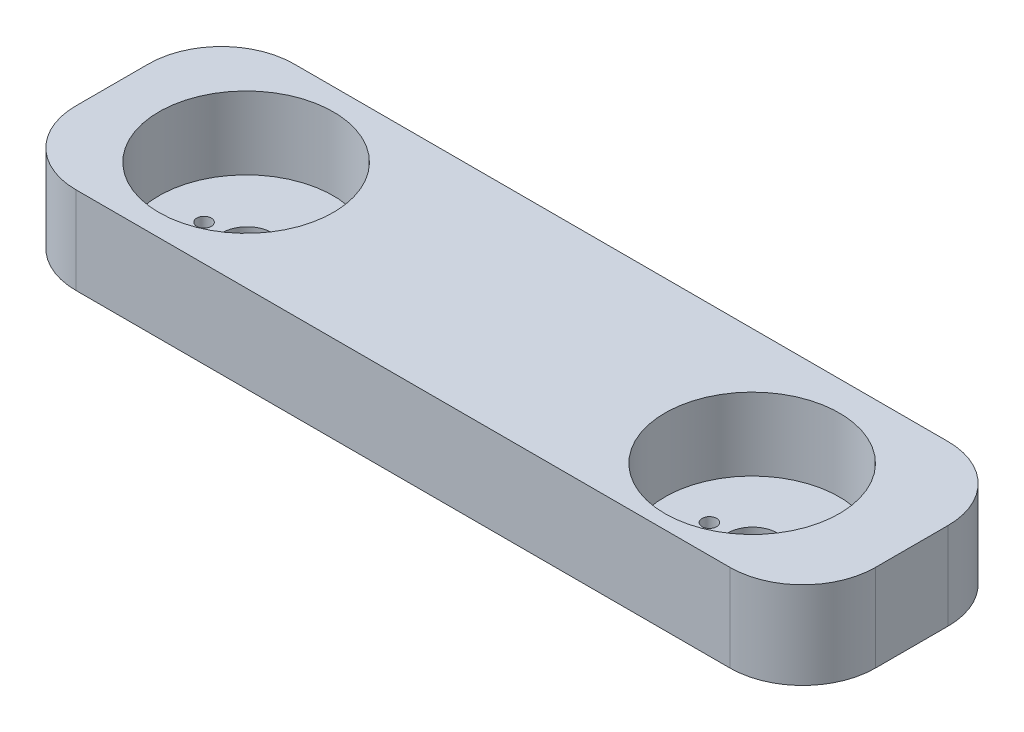
from build123d import *

# Parameters (mm, degrees)
SKETCH1_W           = 110
SKETCH1_H           = 30
BOSS_EXTRUDE1_DEPTH = 12
FILLET1_R           = 10
FILLET2_R           = 10
SKETCH9_R           = 12
CUT_EXTRUDE5_DEPTH  = 10
SKETCH13_R          = 12
CUT_EXTRUDE7_DEPTH  = 10
SKETCH15_R          = 3.43
SKETCH15_R_2        = 1
CUT_EXTRUDE8_DEPTH  = 123.308661002
SKETCH16_R          = 3.43
SKETCH16_R_2        = 1
CUT_EXTRUDE9_DEPTH  = 123.308661002


with BuildPart() as part:
    # Sketch1 → Boss-Extrude1 (new body)
    with BuildSketch(Plane(origin=(0, 0, 0), x_dir=(1, 0, 0), z_dir=(0, 1, 0))):
        with Locations((5.385430756, 3.53837453)):
            Rectangle(SKETCH1_W, SKETCH1_H)
    extrude(amount=BOSS_EXTRUDE1_DEPTH)

    # Fillet1
    fillet1_edges = [part.edges().sort_by_distance(p)[0] for p in [
        (-49.614569244, 6, -18.53837453),
        (-49.614569244, 6, 11.46162547),
    ]]
    fillet(fillet1_edges, radius=FILLET1_R)

    # Fillet2
    fillet2_edges = [part.edges().sort_by_distance(p)[0] for p in [
        (60.385430756, 6, -18.53837453),
        (60.385430756, 6, 11.46162547),
    ]]
    fillet(fillet2_edges, radius=FILLET2_R)

    # Sketch9 → Cut-Extrude5 (cut)
    with BuildSketch(Plane(origin=(0, 12, 0), x_dir=(1, 0, 0), z_dir=(0, 1, 0))):
        with Locations((-31.195762423, 3.53837453)):
            Circle(SKETCH9_R)
    extrude(amount=-CUT_EXTRUDE5_DEPTH, mode=Mode.SUBTRACT)

    # Sketch13 → Cut-Extrude7 (cut)
    with BuildSketch(Plane(origin=(70.696833098, 12, 1.072209922), x_dir=(1, 0, 0), z_dir=(0, 1, 0))):
        with Locations((-31.195762423, 3.53837453)):
            Circle(SKETCH13_R)
    extrude(amount=-CUT_EXTRUDE7_DEPTH, mode=Mode.SUBTRACT)

    # Sketch15 → Cut-Extrude8 (cut, through all)
    with BuildSketch(Plane(origin=(70.696833098, 2, 1.072209922), x_dir=(1, 0, 0), z_dir=(0, 1, 0))):
        with Locations((-31.147671482, 3.53837453)):
            Circle(SKETCH15_R)
        with Locations((-25.217671482, 3.53837453)):
            Circle(SKETCH15_R_2)
        with Locations((-37.077671482, 3.53837453)):
            Circle(SKETCH15_R_2)
    extrude(amount=-CUT_EXTRUDE8_DEPTH, mode=Mode.SUBTRACT)

    # Sketch16 → Cut-Extrude9 (cut, through all)
    with BuildSketch(Plane(origin=(70.696833098, 2, 1.072209922), x_dir=(1, 0, 0), z_dir=(0, 1, 0))):
        with Locations((-101.699594536, 4.556727145)):
            Circle(SKETCH16_R)
        with Locations((-95.769594536, 4.556727145)):
            Circle(SKETCH16_R_2)
        with Locations((-107.629594536, 4.556727145)):
            Circle(SKETCH16_R_2)
    extrude(amount=-CUT_EXTRUDE9_DEPTH, mode=Mode.SUBTRACT)


solid = part.part
